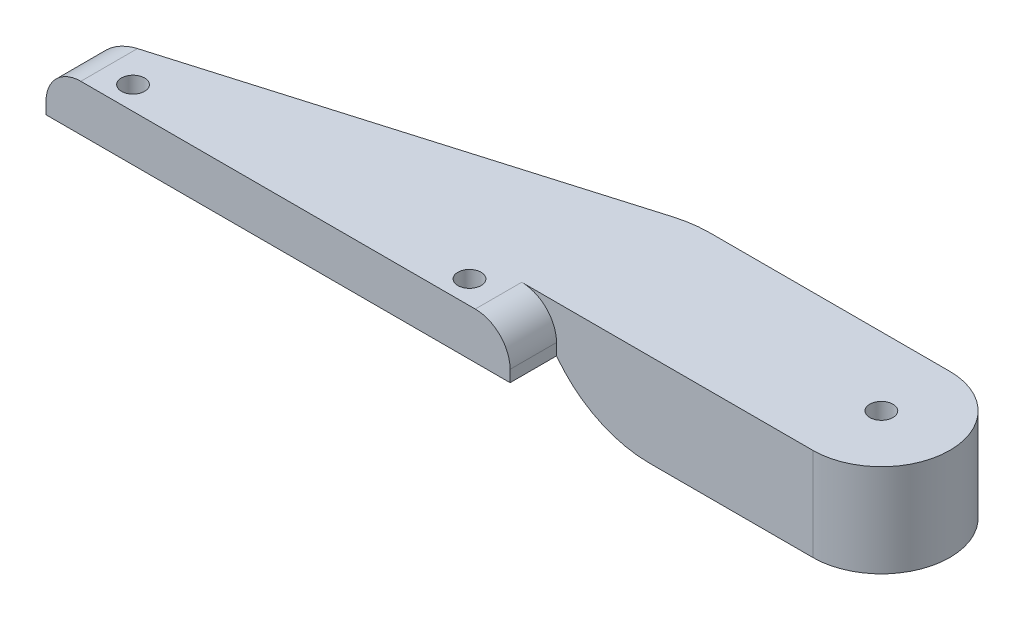
from build123d import *

# Parameters (mm, degrees)
BOSS_EXTRUDE2_DEPTH = 4
BOSS_EXTRUDE3_START = 4
BOSS_EXTRUDE3_DEPTH = 4
CUT_EXTRUDE1_DEPTH  = 4
SKETCH7_R           = 1
CUT_EXTRUDE2_DEPTH  = 51.104291233
SKETCH9_R           = 1
CUT_EXTRUDE8_DEPTH  = 51.58102411
FILLET1_R           = 10
FILLET2_R           = 10
FILLET3_R           = 3


with BuildPart() as part:
    # Sketch1 → Boss-Extrude2 (new body)
    with BuildSketch(Plane(origin=(0, 0, 0), x_dir=(1, 0, 0), z_dir=(0, 1, 0))):
        with BuildLine():
            Line((-20, 2), (20, 13.8))
            Line((20, 13.8), (42.1, 13.8))
            ThreePointArc((42.1, 13.8), (48, 7.9), (42.1, 2))
            Line((42.1, 2), (20, 2))
            Line((20, 2), (20, -2))
            Line((20, -2), (-20, -2))
            Line((-20, -2), (-20, 2))
        make_face()
    extrude(amount=BOSS_EXTRUDE2_DEPTH)

    # Sketch4 → Boss-Extrude3 (add)
    with BuildSketch(Plane(origin=(0, 0, 0), x_dir=(-1, 0, 0), z_dir=(0, -1, 0)).offset(BOSS_EXTRUDE3_START)):
        with BuildLine():
            Line((-20, 2), (-42.1, 2))
            ThreePointArc((-42.1, 2), (-48, 7.9), (-42.1, 13.8))
            Line((-42.1, 13.8), (-20, 13.8))
            Line((-20, 13.8), (-20, 2))
        make_face()
    extrude(amount=-BOSS_EXTRUDE3_DEPTH)

    # Sketch6 → Cut-Extrude1 (cut)
    with BuildSketch(Plane.XZ.offset(4)):
        with BuildLine():
            Line((39.899748285, -4.9), (27.981348848, -5.907102203))
            ThreePointArc((27.981348848, -5.907102203), (25.988451051, -7.9), (27.981348848, -9.892897797))
            Line((27.981348848, -9.892897797), (39.867781655, -10.876291126))
            ThreePointArc((39.867781655, -10.876291126), (45.820310688, -7.919899599), (39.899748285, -4.9))
        make_face()
    extrude(amount=-CUT_EXTRUDE1_DEPTH, mode=Mode.SUBTRACT)

    # Sketch7 → Cut-Extrude2 (cut, through all)
    with BuildSketch(Plane.XZ):
        with Locations(Location((42.1, -7.9, 0), (0, 0, 270))):
            Circle(SKETCH7_R)
    extrude(amount=-CUT_EXTRUDE2_DEPTH, mode=Mode.SUBTRACT)

    # Sketch9 → Cut-Extrude8 (cut, through all)
    with BuildSketch(Plane(origin=(0, 4, 0), x_dir=(1, 0, 0), z_dir=(0, 1, 0))):
        with Locations(Location((-14.5, 0, 0), (0, 0, 270))):
            Circle(SKETCH9_R)
        with Locations(Location((14.5, 0, 0), (0, 0, 270))):
            Circle(SKETCH9_R)
    extrude(amount=-CUT_EXTRUDE8_DEPTH, mode=Mode.SUBTRACT)

    # Fillet1
    # the kernel refuses this fillet: 10 mm, written as the material it takes off along each edge
    with BuildSketch(Plane(origin=(20, -4, -33.8), x_dir=(1, 0, 0), z_dir=(0, 0, 1))) as fillet1_piece_1:
        with BuildLine():
            CenterArc((8, 10), FILLET1_R, 216.869897646, 53.130102354)
            Line((0, 4), (-0.16, 3.88))
            ThreePointArc((-0.16, 3.88), (-0.2, 2), (-0.2, 0))
            Line((-0.2, 0), (0, -0.2))
            Line((0, -0.2), (8, -0.2))
            Line((8, -0.2), (8, 0))
        make_face()
    extrude(amount=51.8, mode=Mode.SUBTRACT)

    # Fillet2
    fillet2_edges = [part.edges().sort_by_distance(p)[0] for p in [
        (20, 2, -13.8),
    ]]
    fillet(fillet2_edges, radius=FILLET2_R)

    # Fillet3
    fillet3_edges = [part.edges().sort_by_distance(p)[0] for p in [
        (-20, 4, 0),
        (20, 4, 0),
    ]]
    fillet(fillet3_edges, radius=FILLET3_R)


solid = part.part
